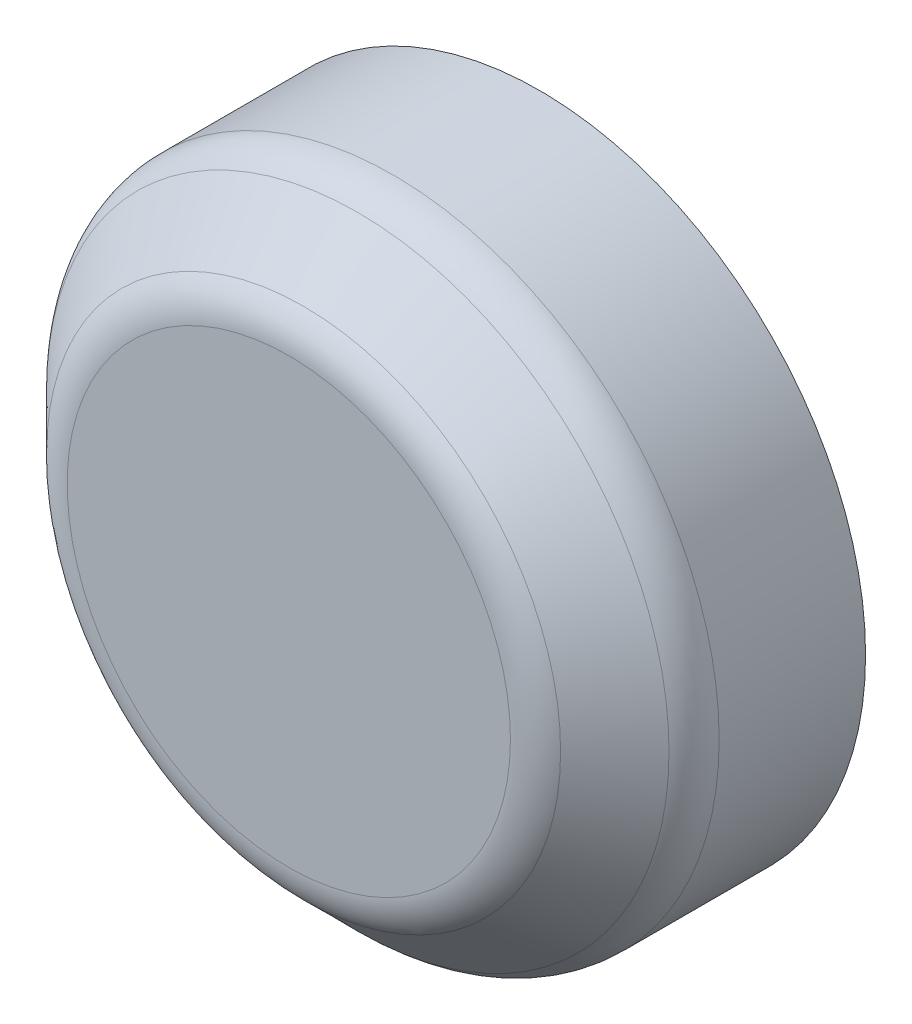
from build123d import *

# Parameters (mm, degrees)
SKETCH1_R           = 19.5
BOSS_EXTRUDE1_DEPTH = 15
CHAMFER1_SIZE       = 5
FILLET1_R           = 3
SHELL1_T            = -3


with BuildPart() as part:
    # Sketch1 → Boss-Extrude1 (new body)
    with BuildSketch(Plane.XY):
        Circle(SKETCH1_R)
    extrude(amount=BOSS_EXTRUDE1_DEPTH)

    # Chamfer1
    chamfer1_edges = [part.edges().sort_by_distance(p)[0] for p in [
        (-19.5, 0, 15),
    ]]
    chamfer(chamfer1_edges, length=CHAMFER1_SIZE)

    # Fillet1
    fillet1_edges = [part.edges().sort_by_distance(p)[0] for p in [
        (-14.5, 0, 15),
        (-19.5, 0, 10),
    ]]
    fillet(fillet1_edges, radius=FILLET1_R)

    # Shell1
    shell1_openings = [part.faces().sort_by_distance(p)[0] for p in [
        (0, 0, 0),
    ]]
    offset(amount=SHELL1_T, openings=shell1_openings, kind=Kind.INTERSECTION)

    # Fillet2: read off the stored shape, not the designer's step
    # Fillet2 outline → Fillet2 (revolve)
    with BuildSketch(Plane.XZ):
        with BuildLine():
            Line((16.5, 9.636038969), (15.621320344, 9.636038969))
            ThreePointArc((15.621320344, 9.636038969), (16.271638598, 8.662768923), (16.5, 7.514718626))
            Line((16.5, 7.514718626), (16.5, 9.636038969))
        make_face()
        with BuildLine():
            ThreePointArc((12.014718626, 12), (13.162768923, 11.771638598), (14.136038969, 11.121320344))
            Line((14.136038969, 11.121320344), (14.136038969, 12))
            Line((14.136038969, 12), (12.014718626, 12))
        make_face()
    revolve(axis=Axis((0, 0, 0), (0, 0, 1)))


solid = part.part
